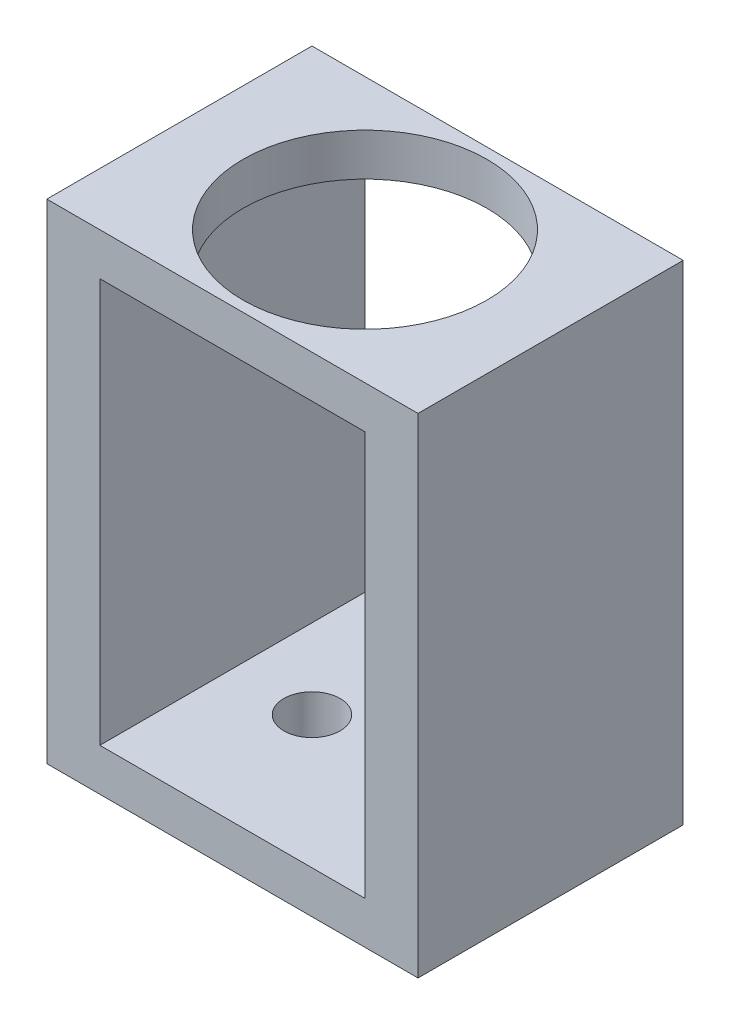
from build123d import *

# Parameters (mm, degrees)
SKETCH1_W           = 25
SKETCH1_H           = 25
SKETCH1_R           = 2.65
BOSS_EXTRUDE1_DEPTH = 4
SKETCH2_W           = 5
SKETCH2_H           = 25
BOSS_EXTRUDE2_DEPTH = 42.1
SKETCH3_W           = 35
SKETCH3_H           = 25
SKETCH3_R           = 11.5
BOSS_EXTRUDE3_DEPTH = 4


with BuildPart() as part:
    # Sketch1 → Boss-Extrude1 (new body)
    with BuildSketch(Plane(origin=(0, 0, 0), x_dir=(1, 0, 0), z_dir=(0, 1, 0))):
        with Locations((12.5, 12.5)):
            Rectangle(SKETCH1_W, SKETCH1_H)
        with Locations((7.5, 12.5)):
            Circle(SKETCH1_R, mode=Mode.SUBTRACT)
        with Locations((17.5, 12.5)):
            Circle(SKETCH1_R, mode=Mode.SUBTRACT)
    extrude(amount=BOSS_EXTRUDE1_DEPTH)

    # Sketch2 → Boss-Extrude2 (add)
    with BuildSketch(Plane.XZ):
        with Locations((-2.5, -12.5)):
            Rectangle(SKETCH2_W, SKETCH2_H)
        with Locations((27.5, -12.5)):
            Rectangle(SKETCH2_W, SKETCH2_H)
    extrude(amount=-BOSS_EXTRUDE2_DEPTH)

    # Sketch3 → Boss-Extrude3 (add)
    with BuildSketch(Plane(origin=(0, 42.1, 0), x_dir=(1, 0, 0), z_dir=(0, 1, 0))):
        with Locations((12.5, 12.5)):
            Rectangle(SKETCH3_W, SKETCH3_H)
        with Locations((12.5, 12.5)):
            Circle(SKETCH3_R, mode=Mode.SUBTRACT)
    extrude(amount=BOSS_EXTRUDE3_DEPTH)


solid = part.part
